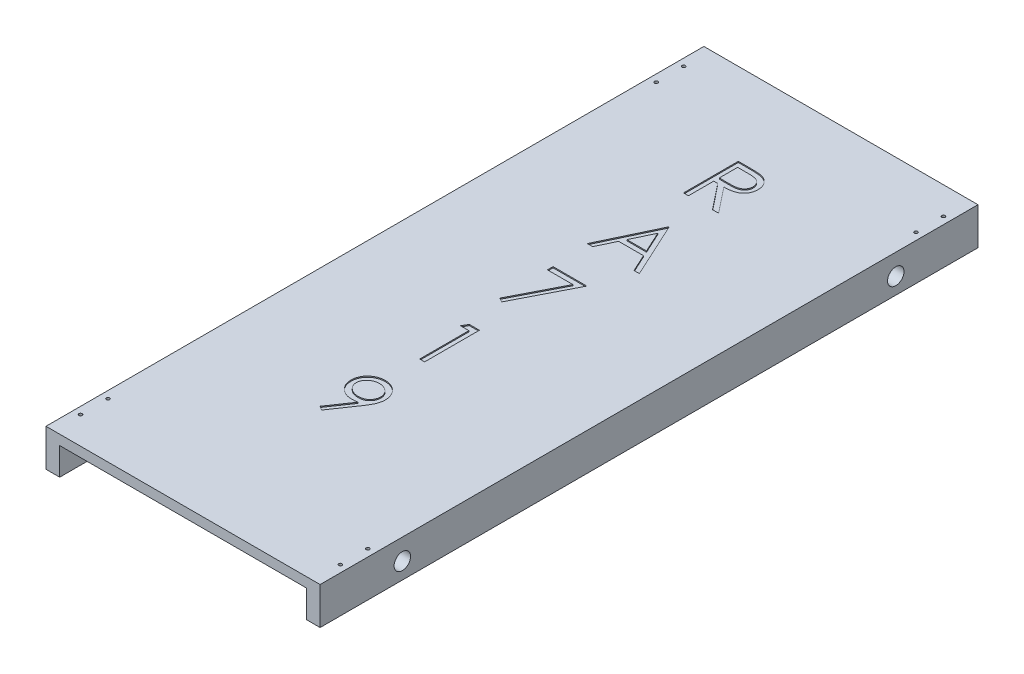
from build123d import *

# Parameters (mm, degrees)
BOSS_EXTRUDE1_DEPTH                = 1200
SKETCH3_R                          = 15
CUT_EXTRUDE1_DEPTH                 = 1302.77724669
CUT_EXTRUDE2_DEPTH                 = 2
CUT_EXTRUDE3_DEPTH                 = 2
F_6_0_6_DIAMETER_HOLE1_D           = 6
F_6_0_6_DIAMETER_HOLE1_CSINK_D     = 6.05
F_6_0_6_DIAMETER_HOLE1_CSINK_ANGLE = 90


with BuildPart() as part:
    # Sketch2 → Boss-Extrude1 (new body)
    with BuildSketch(Plane.XY):
        Polygon((0, 0), (0, 68), (500, 68), (500, 0), (475, 0), (475, 50), (25, 50), (25, 0), align=None)
    extrude(amount=BOSS_EXTRUDE1_DEPTH)

    # Sketch3 → Cut-Extrude1 (cut, through all)
    with BuildSketch(Plane(origin=(500, 0, 0), x_dir=(0, 0, -1), z_dir=(1, 0, 0))):
        with Locations((-1050, 30)):
            Circle(SKETCH3_R)
        with Locations((-150, 30)):
            Circle(SKETCH3_R)
    extrude(amount=-CUT_EXTRUDE1_DEPTH, mode=Mode.SUBTRACT)

    # Sketch4 → Cut-Extrude2 (cut)
    # profile 1 of 5: a face of its own
    with BuildSketch(Plane(origin=(0, 68, 0), x_dir=(1, 0, 0), z_dir=(0, 1, 0))):
        with BuildLine():
            Line((212.820512821, -150), (232.832532051, -150))
            add(Edge.make_bspline(
                [(232.832532051, -150), (234.167992866, -150.004445314), (236.732225563, -150.012980809), (240.405747574, -150.060574035), (243.743664631, -150.196984198), (246.744231468, -150.314372298), (249.407393039, -150.528427764), (251.741315632, -150.733017682), (253.735249846, -151.000836561), (254.942274169, -151.249562931), (255.488782051, -151.362179487)],
                knots=[0, 0, 0, 0, 1.410062039, 2.707475311, 3.878576406, 4.937260626, 5.877586885, 6.699081471, 7.410979367, 8, 8, 8, 8], degree=3))
            add(Edge.make_bspline(
                [(255.488782051, -151.362179487), (256.220399884, -151.542944212), (257.668028154, -151.900617459), (259.752315756, -152.656606054), (261.738439297, -153.531452472), (263.618148563, -154.558987338), (265.382028312, -155.746838186), (267.048265763, -157.074498827), (268.624421859, -158.534704706), (270.04675415, -160.164271606), (271.387869913, -161.873886168), (272.518973527, -163.722564935), (273.494015805, -165.655751436), (274.270316291, -167.693106229), (274.895401247, -169.814871139), (275.336150944, -172.040265332), (275.60047059, -174.359150334), (275.627380749, -175.940804871), (275.641025641, -176.742788462)],
                knots=[0, 0, 0, 0, 1.027469482, 2.033020251, 3.019912614, 3.986113645, 4.951240523, 5.91722682, 6.890402269, 7.87763091, 8.8651537, 9.85103654, 10.82876324, 11.815024772, 12.821070561, 13.842952187, 14.906261191, 16, 16, 16, 16], degree=3))
            add(Edge.make_bspline(
                [(275.641025641, -176.742788462), (275.599054266, -178.075220022), (275.517157244, -180.675139104), (274.753582853, -184.448307145), (273.502825147, -187.968001849), (271.779302603, -191.229791503), (269.58446044, -194.170095657), (266.946609266, -196.752680094), (263.864277509, -198.913820453), (260.994868482, -200.412472016), (258.460177062, -201.372269406), (256.373510983, -202.047593945), (254.097311626, -202.569364381), (251.65338778, -203.036796717), (249.031569051, -203.389702272), (246.238139354, -203.6481764), (243.271106451, -203.809720648), (241.232847326, -203.833777931), (240.184294872, -203.846153846)],
                knots=[0, 0, 0, 0, 1.260483769, 2.459530307, 3.627416485, 4.787058657, 5.939039949, 7.08810263, 8.267026773, 9.491475466, 10.141966685, 10.831826277, 11.566392101, 12.351337768, 13.187381173, 14.07005841, 15.007169909, 16, 16, 16, 16], degree=3))
            Line((240.184294872, -203.846153846), (276.923076923, -250))
            Line((276.923076923, -250), (265.825320513, -250))
            Line((265.825320513, -250), (229.086538462, -203.846153846))
            Line((229.086538462, -203.846153846), (221.794871795, -203.846153846))
            Line((221.794871795, -203.846153846), (221.794871795, -250))
            Line((221.794871795, -250), (212.820512821, -250))
            Line((212.820512821, -250), (212.820512821, -150))
        make_face()
        with BuildLine():
            Line((221.794871795, -160.256410256), (221.794871795, -193.58974359))
            Line((221.794871795, -193.58974359), (240.104166667, -193.729967949))
            add(Edge.make_bspline(
                [(240.104166667, -193.729967949), (240.959024922, -193.730346139), (242.615983696, -193.731079179), (245.013145548, -193.616971286), (247.245148739, -193.487162194), (249.303455944, -193.288609464), (251.188986668, -193.0327217), (252.900798474, -192.712636436), (254.441685671, -192.339720361), (256.238786769, -191.762531052), (258.245544808, -190.848073387), (260.426443661, -189.517630567), (262.283653311, -187.844227163), (263.852735091, -185.930699847), (265.113575991, -183.826807023), (266.002491829, -181.557767903), (266.566561609, -179.180865103), (266.633091479, -177.547204879), (266.666666667, -176.72275641)],
                knots=[0, 0, 0, 0, 1.146690395, 2.22261258, 3.21895312, 4.145990853, 4.996080663, 5.770904154, 6.481378293, 7.121626537, 8.300444488, 9.431385265, 10.535395872, 11.636531494, 12.74115979, 13.810798291, 14.895190096, 16, 16, 16, 16], degree=3))
            add(Edge.make_bspline(
                [(266.666666667, -176.72275641), (266.63232035, -175.918568589), (266.564258483, -174.32496177), (266.008579382, -171.991935762), (265.068882772, -169.790022901), (263.802533117, -167.728180473), (262.259700118, -165.85658802), (260.450619755, -164.255240789), (258.424757036, -162.933827513), (256.531294226, -162.089416641), (254.838888155, -161.571706548), (253.369469297, -161.207387582), (251.709141362, -160.91468847), (249.849842545, -160.680172445), (247.799510236, -160.478602609), (245.547777348, -160.342837505), (243.109583626, -160.262441388), (241.419671307, -160.25846742), (240.544871795, -160.256410256)],
                knots=[0, 0, 0, 0, 1.101028733, 2.181837193, 3.264309656, 4.369019818, 5.486613113, 6.575447106, 7.666700264, 8.788928104, 9.402425223, 10.0903467, 10.862060571, 11.710948788, 12.657782767, 13.684531032, 14.801375019, 16, 16, 16, 16], degree=3))
            Line((240.544871795, -160.256410256), (221.794871795, -160.256410256))
        make_face(mode=Mode.SUBTRACT)
    # profile 2 of 5: a face of its own
    with BuildSketch(Plane(origin=(0, 68, 0), x_dir=(1, 0, 0), z_dir=(0, 1, 0))):
        Polygon((253.846153846, -317.666666667), (300, -417.666666667), (290.244391026, -417.666666667), (275.460737179, -385.615384615), (230.128205128, -385.615384615), (214.923878205, -417.666666667), (205.128205128, -417.666666667), (252.564102564, -317.666666667), align=None)
        Polygon((253.104967949, -337.157852564), (234.99599359, -375.358974359), (270.733173077, -375.358974359), align=None, mode=Mode.SUBTRACT)
    # profile 3 of 5: a face of its own
    with BuildSketch(Plane(origin=(0, 68, 0), x_dir=(1, 0, 0), z_dir=(0, 1, 0))):
        Polygon((210.256410256, -485.333333333), (271.794871795, -485.333333333), (219.230769231, -587.897435897), (211.478365385, -583.630608974), (256.610576923, -495.58974359), (210.256410256, -495.58974359), align=None)
    # profile 4 of 5: a face of its own
    with BuildSketch(Plane(origin=(0, 68, 0), x_dir=(1, 0, 0), z_dir=(0, 1, 0))):
        Polygon((225.100160256, -653), (243.58974359, -653), (243.58974359, -753), (234.615384615, -753), (234.615384615, -663.256410256), (219.230769231, -663.256410256), align=None)
    # profile 5 of 5: a face of its own
    with BuildSketch(Plane(origin=(0, 68, 0), x_dir=(1, 0, 0), z_dir=(0, 1, 0))):
        with BuildLine():
            Line((225.641025641, -923.230769231), (218.469551282, -918.242788462))
            Line((218.469551282, -918.242788462), (246.274038462, -877.59775641))
            add(Edge.make_bspline(
                [(246.274038462, -877.59775641), (244.500017444, -877.814701077), (241.006871155, -878.24187722), (237.488668238, -878.320353069), (235.757211538, -878.358974359)],
                knots=[0, 0, 0, 0, 1.015715272, 2, 2, 2, 2], degree=3))
            add(Edge.make_bspline(
                [(235.757211538, -878.358974359), (234.707438744, -878.33208646), (232.646826549, -878.279307866), (229.617350762, -877.860970486), (226.706334746, -877.216681121), (223.921496005, -876.255288119), (221.252367295, -875.060482147), (218.704775484, -873.578853186), (216.282150041, -871.835816284), (214.010509757, -869.840587954), (211.944460074, -867.649786455), (210.103794424, -865.3310538), (208.574047796, -862.857454638), (207.303288214, -860.279448365), (206.339560969, -857.559981198), (205.637774181, -854.729998337), (205.205706913, -851.769665709), (205.154304183, -849.754661973), (205.128205128, -848.731570513)],
                knots=[0, 0, 0, 0, 1.060718605, 2.082097864, 3.085795603, 4.069760067, 5.054557537, 6.03741023, 7.043284206, 8.066802108, 9.088538119, 10.083643548, 11.053783639, 12.022749082, 12.983451788, 13.964007469, 14.966251758, 16, 16, 16, 16], degree=3))
            add(Edge.make_bspline(
                [(205.128205128, -848.731570513), (205.177760408, -847.332466149), (205.275027369, -844.586308105), (206.057842148, -840.573914704), (207.34528041, -836.780013458), (209.140376889, -833.214579346), (211.40136893, -829.928901083), (214.118757221, -826.968655108), (217.276013343, -824.375944998), (220.80121389, -822.147257072), (224.611300197, -820.354828578), (228.601833285, -819.033705707), (232.742236716, -818.256598626), (235.547027291, -818.154145451), (236.959134615, -818.102564103)],
                knots=[0, 0, 0, 0, 1.022988612, 2.007919123, 2.978103895, 3.94594894, 4.918897164, 5.887013414, 6.875921846, 7.89917871, 8.930658928, 9.948724884, 10.967259574, 12, 12, 12, 12], degree=3))
            add(Edge.make_bspline(
                [(236.959134615, -818.102564103), (238.344518032, -818.154854476), (241.081905084, -818.258175324), (245.107305272, -819.014860155), (248.962762899, -820.290193664), (252.626905376, -822.052609771), (256.019460011, -824.261778562), (259.070197474, -826.894193526), (261.709498591, -829.951494304), (263.933038041, -833.359736877), (265.717896335, -837.021650625), (267.005675849, -840.844048411), (267.798408391, -844.799440448), (267.898303451, -847.479282564), (267.948717949, -848.831730769)],
                knots=[0, 0, 0, 0, 1.026385292, 2.028040595, 3.023318987, 4.028184125, 5.03290303, 6.015178782, 7.004435299, 8.016004309, 9.023023918, 10.015172535, 10.998308025, 12, 12, 12, 12], degree=3))
            add(Edge.make_bspline(
                [(267.948717949, -848.831730769), (267.915049123, -849.881552688), (267.84676033, -852.01085385), (267.368580127, -855.246006502), (266.556574835, -858.544613059), (265.635097729, -861.336658651), (264.745607224, -863.642614359), (263.908432033, -865.464088073), (262.979513361, -867.381267025), (261.896120061, -869.374048108), (260.731483012, -871.467834821), (259.415503682, -873.6416267), (257.978201631, -875.898340791), (256.954495353, -877.419686163), (256.430288462, -878.198717949)],
                knots=[0, 0, 0, 0, 1.179839688, 2.393009684, 3.667231171, 4.993948276, 5.694988576, 6.444077775, 7.246288328, 8.089075292, 8.993003841, 9.939041771, 10.944649915, 12, 12, 12, 12], degree=3))
            Line((256.430288462, -878.198717949), (225.641025641, -923.230769231))
        make_face()
        with BuildLine():
            add(Edge.make_bspline(
                [(237.419871795, -868.102564103), (238.215129341, -868.080838852), (239.763225429, -868.038547175), (242.031148258, -867.781140264), (244.171839784, -867.324740661), (246.191018336, -866.669891745), (248.108929819, -865.879701205), (249.895110625, -864.87364446), (251.551055631, -863.673169176), (253.087853547, -862.324311586), (254.452539254, -860.825723484), (255.668054417, -859.257234722), (256.701213486, -857.611960152), (257.517307117, -855.869295515), (258.188294987, -854.071660988), (258.65166676, -852.190107981), (258.908361996, -850.234439391), (258.952121279, -848.905906305), (258.974358974, -848.230769231)],
                knots=[0, 0, 0, 0, 1.163407946, 2.26475976, 3.333800367, 4.359385343, 5.366239384, 6.363380779, 7.350133999, 8.353570782, 9.349036268, 10.310270964, 11.253520213, 12.184142, 13.120487599, 14.056272588, 15.012232024, 16, 16, 16, 16], degree=3))
            add(Edge.make_bspline(
                [(258.974358974, -848.230769231), (258.955225569, -847.555350224), (258.917520848, -846.224354225), (258.61502657, -844.265790228), (258.082877338, -842.388839919), (257.36886349, -840.583227635), (256.428285266, -838.863788439), (255.299614245, -837.208934959), (253.958687108, -835.62915988), (252.415756646, -834.161617492), (250.751912275, -832.808820371), (248.978755125, -831.614932486), (247.110900382, -830.614326875), (245.159743529, -829.788642022), (243.121219274, -829.144305574), (240.996533896, -828.680952298), (238.774950882, -828.424616453), (237.266914134, -828.381133753), (236.498397436, -828.358974359)],
                knots=[0, 0, 0, 0, 0.972161553, 1.915763587, 2.844109794, 3.775983486, 4.705125789, 5.659731448, 6.655561913, 7.682237399, 8.721216875, 9.739758359, 10.754845918, 11.767244016, 12.7857855, 13.828538656, 14.893392813, 16, 16, 16, 16], degree=3))
            add(Edge.make_bspline(
                [(236.498397436, -828.358974359), (235.736564483, -828.38116955), (234.241854503, -828.424716332), (232.040021376, -828.680465051), (229.929702295, -829.147421743), (227.897084573, -829.788343565), (225.945985696, -830.614388469), (224.078219049, -831.614984916), (222.304647143, -832.808545551), (220.642397977, -834.162681907), (219.096743061, -835.622328939), (217.778870804, -837.21585548), (216.647616745, -838.862927607), (215.70833095, -840.583456414), (214.993973313, -842.388778859), (214.461916124, -844.265806767), (214.159397117, -846.224349915), (214.121695787, -847.555348774), (214.102564103, -848.230769231)],
                knots=[0, 0, 0, 0, 1.099389452, 2.15699305, 3.192601482, 4.213358962, 5.227959689, 6.245255729, 7.266013209, 8.307253147, 9.336162325, 10.327954924, 11.284637477, 12.215801273, 13.149702402, 14.080068371, 15.025723358, 16, 16, 16, 16], degree=3))
            add(Edge.make_bspline(
                [(214.102564103, -848.230769231), (214.119876277, -848.906432052), (214.154019054, -850.2389628), (214.483384475, -852.196859739), (215.03419247, -854.073665282), (215.771889344, -855.887628339), (216.743363348, -857.62111), (217.93547329, -859.265891769), (219.332774605, -860.840618917), (220.916588539, -862.32082497), (222.649964566, -863.679458557), (224.501300169, -864.8660409), (226.43872408, -865.868110741), (228.469056388, -866.672150281), (230.57725067, -867.318197809), (232.782254424, -867.780299104), (235.076775495, -868.036078154), (236.631346404, -868.080189496), (237.419871795, -868.102564103)],
                knots=[0, 0, 0, 0, 0.952633368, 1.87876736, 2.791047057, 3.707742249, 4.635551637, 5.587206343, 6.568248508, 7.601284464, 8.641511608, 9.671105535, 10.699146789, 11.713763218, 12.747829548, 13.806491675, 14.887386225, 16, 16, 16, 16], degree=3))
        make_face(mode=Mode.SUBTRACT)
    extrude(amount=-CUT_EXTRUDE2_DEPTH, mode=Mode.SUBTRACT)

    # Sketch5 → Cut-Extrude3 (cut)
    # profile 1 of 5: a face of its own
    with BuildSketch(Plane.XZ.offset(-50)):
        with BuildLine():
            Line((212.820512821, 1050), (232.832532051, 1050))
            add(Edge.make_bspline(
                [(232.832532051, 1050), (234.167992866, 1049.995554686), (236.732225563, 1049.987019191), (240.405747574, 1049.939425965), (243.743664631, 1049.803015802), (246.744231468, 1049.685627702), (249.407393039, 1049.471572236), (251.741315632, 1049.266982318), (253.735249846, 1048.999163439), (254.942274169, 1048.750437069), (255.488782051, 1048.637820513)],
                knots=[0, 0, 0, 0, 1.410062039, 2.707475311, 3.878576406, 4.937260626, 5.877586885, 6.699081471, 7.410979367, 8, 8, 8, 8], degree=3))
            add(Edge.make_bspline(
                [(255.488782051, 1048.637820513), (256.220399884, 1048.457055788), (257.668028154, 1048.099382541), (259.752315756, 1047.343393946), (261.738439297, 1046.468547528), (263.618148563, 1045.441012662), (265.382028312, 1044.253161814), (267.048265763, 1042.925501173), (268.624421859, 1041.465295294), (270.04675415, 1039.835728394), (271.387869913, 1038.126113832), (272.518973527, 1036.277435065), (273.494015805, 1034.344248564), (274.270316291, 1032.306893771), (274.895401247, 1030.185128861), (275.336150944, 1027.959734668), (275.60047059, 1025.640849666), (275.627380749, 1024.059195129), (275.641025641, 1023.257211538)],
                knots=[0, 0, 0, 0, 1.027469482, 2.033020251, 3.019912614, 3.986113645, 4.951240523, 5.91722682, 6.890402269, 7.87763091, 8.8651537, 9.85103654, 10.82876324, 11.815024772, 12.821070561, 13.842952187, 14.906261191, 16, 16, 16, 16], degree=3))
            add(Edge.make_bspline(
                [(275.641025641, 1023.257211538), (275.599054266, 1021.924779978), (275.517157244, 1019.324860896), (274.753582853, 1015.551692855), (273.502825147, 1012.031998151), (271.779302603, 1008.770208497), (269.58446044, 1005.829904343), (266.946609266, 1003.247319906), (263.864277509, 1001.086179547), (260.994868482, 999.587527984), (258.460177062, 998.627730594), (256.373510983, 997.952406055), (254.097311626, 997.430635619), (251.65338778, 996.963203283), (249.031569051, 996.610297728), (246.238139354, 996.3518236), (243.271106451, 996.190279352), (241.232847326, 996.166222069), (240.184294872, 996.153846154)],
                knots=[0, 0, 0, 0, 1.260483769, 2.459530307, 3.627416485, 4.787058657, 5.939039949, 7.08810263, 8.267026773, 9.491475466, 10.141966685, 10.831826277, 11.566392101, 12.351337768, 13.187381173, 14.07005841, 15.007169909, 16, 16, 16, 16], degree=3))
            Line((240.184294872, 996.153846154), (276.923076923, 950))
            Line((276.923076923, 950), (265.825320513, 950))
            Line((265.825320513, 950), (229.086538462, 996.153846154))
            Line((229.086538462, 996.153846154), (221.794871795, 996.153846154))
            Line((221.794871795, 996.153846154), (221.794871795, 950))
            Line((221.794871795, 950), (212.820512821, 950))
            Line((212.820512821, 950), (212.820512821, 1050))
        make_face()
        with BuildLine():
            Line((221.794871795, 1039.743589744), (221.794871795, 1006.41025641))
            Line((221.794871795, 1006.41025641), (240.104166667, 1006.270032051))
            add(Edge.make_bspline(
                [(240.104166667, 1006.270032051), (240.959024922, 1006.269653861), (242.615983696, 1006.268920821), (245.013145548, 1006.383028714), (247.245148739, 1006.512837806), (249.303455944, 1006.711390536), (251.188986668, 1006.9672783), (252.900798474, 1007.287363564), (254.441685671, 1007.660279639), (256.238786769, 1008.237468948), (258.245544808, 1009.151926613), (260.426443661, 1010.482369433), (262.283653311, 1012.155772837), (263.852735091, 1014.069300153), (265.113575991, 1016.173192977), (266.002491829, 1018.442232097), (266.566561609, 1020.819134897), (266.633091479, 1022.452795121), (266.666666667, 1023.27724359)],
                knots=[0, 0, 0, 0, 1.146690395, 2.22261258, 3.21895312, 4.145990853, 4.996080663, 5.770904154, 6.481378293, 7.121626537, 8.300444488, 9.431385265, 10.535395872, 11.636531494, 12.74115979, 13.810798291, 14.895190096, 16, 16, 16, 16], degree=3))
            add(Edge.make_bspline(
                [(266.666666667, 1023.27724359), (266.63232035, 1024.081431411), (266.564258483, 1025.67503823), (266.008579382, 1028.008064238), (265.068882772, 1030.209977099), (263.802533117, 1032.271819527), (262.259700118, 1034.14341198), (260.450619755, 1035.744759211), (258.424757036, 1037.066172487), (256.531294226, 1037.910583359), (254.838888155, 1038.428293452), (253.369469297, 1038.792612418), (251.709141362, 1039.08531153), (249.849842545, 1039.319827555), (247.799510236, 1039.521397391), (245.547777348, 1039.657162495), (243.109583626, 1039.737558612), (241.419671307, 1039.74153258), (240.544871795, 1039.743589744)],
                knots=[0, 0, 0, 0, 1.101028733, 2.181837193, 3.264309656, 4.369019818, 5.486613113, 6.575447106, 7.666700264, 8.788928104, 9.402425223, 10.0903467, 10.862060571, 11.710948788, 12.657782767, 13.684531032, 14.801375019, 16, 16, 16, 16], degree=3))
            Line((240.544871795, 1039.743589744), (221.794871795, 1039.743589744))
        make_face(mode=Mode.SUBTRACT)
    # profile 2 of 5: a face of its own
    with BuildSketch(Plane.XZ.offset(-50)):
        Polygon((253.846153846, 882.333333333), (300, 782.333333333), (290.244391026, 782.333333333), (275.460737179, 814.384615385), (230.128205128, 814.384615385), (214.923878205, 782.333333333), (205.128205128, 782.333333333), (252.564102564, 882.333333333), align=None)
        Polygon((253.104967949, 862.842147436), (234.99599359, 824.641025641), (270.733173077, 824.641025641), align=None, mode=Mode.SUBTRACT)
    # profile 3 of 5: a face of its own
    with BuildSketch(Plane.XZ.offset(-50)):
        Polygon((210.256410256, 714.666666667), (271.794871795, 714.666666667), (219.230769231, 612.102564103), (211.478365385, 616.369391026), (256.610576923, 704.41025641), (210.256410256, 704.41025641), align=None)
    # profile 4 of 5: a face of its own
    with BuildSketch(Plane.XZ.offset(-50)):
        Polygon((225.100160256, 547), (243.58974359, 547), (243.58974359, 447), (234.615384615, 447), (234.615384615, 536.743589744), (219.230769231, 536.743589744), align=None)
    # profile 5 of 5: a face of its own
    with BuildSketch(Plane.XZ.offset(-50)):
        with BuildLine():
            Line((225.641025641, 276.769230769), (218.469551282, 281.757211538))
            Line((218.469551282, 281.757211538), (246.274038462, 322.40224359))
            add(Edge.make_bspline(
                [(246.274038462, 322.40224359), (244.500017444, 322.185298923), (241.006871155, 321.75812278), (237.488668238, 321.679646931), (235.757211538, 321.641025641)],
                knots=[0, 0, 0, 0, 1.015715272, 2, 2, 2, 2], degree=3))
            add(Edge.make_bspline(
                [(235.757211538, 321.641025641), (234.707438744, 321.66791354), (232.646826549, 321.720692134), (229.617350762, 322.139029514), (226.706334746, 322.783318879), (223.921496005, 323.744711881), (221.252367295, 324.939517853), (218.704775484, 326.421146814), (216.282150041, 328.164183716), (214.010509757, 330.159412046), (211.944460074, 332.350213545), (210.103794424, 334.6689462), (208.574047796, 337.142545362), (207.303288214, 339.720551635), (206.339560969, 342.440018802), (205.637774181, 345.270001663), (205.205706913, 348.230334291), (205.154304183, 350.245338027), (205.128205128, 351.268429487)],
                knots=[0, 0, 0, 0, 1.060718605, 2.082097864, 3.085795603, 4.069760067, 5.054557537, 6.03741023, 7.043284206, 8.066802108, 9.088538119, 10.083643548, 11.053783639, 12.022749082, 12.983451788, 13.964007469, 14.966251758, 16, 16, 16, 16], degree=3))
            add(Edge.make_bspline(
                [(205.128205128, 351.268429487), (205.177760408, 352.667533851), (205.275027369, 355.413691895), (206.057842148, 359.426085296), (207.34528041, 363.219986542), (209.140376889, 366.785420654), (211.40136893, 370.071098917), (214.118757221, 373.031344892), (217.276013343, 375.624055002), (220.80121389, 377.852742928), (224.611300197, 379.645171422), (228.601833285, 380.966294293), (232.742236716, 381.743401374), (235.547027291, 381.845854549), (236.959134615, 381.897435897)],
                knots=[0, 0, 0, 0, 1.022988612, 2.007919123, 2.978103895, 3.94594894, 4.918897164, 5.887013414, 6.875921846, 7.89917871, 8.930658928, 9.948724884, 10.967259574, 12, 12, 12, 12], degree=3))
            add(Edge.make_bspline(
                [(236.959134615, 381.897435897), (238.344518032, 381.845145524), (241.081905084, 381.741824676), (245.107305272, 380.985139845), (248.962762899, 379.709806336), (252.626905376, 377.947390229), (256.019460011, 375.738221438), (259.070197474, 373.105806474), (261.709498591, 370.048505696), (263.933038041, 366.640263123), (265.717896335, 362.978349375), (267.005675849, 359.155951589), (267.798408391, 355.200559552), (267.898303451, 352.520717436), (267.948717949, 351.168269231)],
                knots=[0, 0, 0, 0, 1.026385292, 2.028040595, 3.023318987, 4.028184125, 5.03290303, 6.015178782, 7.004435299, 8.016004309, 9.023023918, 10.015172535, 10.998308025, 12, 12, 12, 12], degree=3))
            add(Edge.make_bspline(
                [(267.948717949, 351.168269231), (267.915049123, 350.118447312), (267.84676033, 347.98914615), (267.368580127, 344.753993498), (266.556574835, 341.455386941), (265.635097729, 338.663341349), (264.745607224, 336.357385641), (263.908432033, 334.535911927), (262.979513361, 332.618732975), (261.896120061, 330.625951892), (260.731483012, 328.532165179), (259.415503682, 326.3583733), (257.978201631, 324.101659209), (256.954495353, 322.580313837), (256.430288462, 321.801282051)],
                knots=[0, 0, 0, 0, 1.179839688, 2.393009684, 3.667231171, 4.993948276, 5.694988576, 6.444077775, 7.246288328, 8.089075292, 8.993003841, 9.939041771, 10.944649915, 12, 12, 12, 12], degree=3))
            Line((256.430288462, 321.801282051), (225.641025641, 276.769230769))
        make_face()
        with BuildLine():
            add(Edge.make_bspline(
                [(237.419871795, 331.897435897), (238.215129341, 331.919161148), (239.763225429, 331.961452825), (242.031148258, 332.218859736), (244.171839784, 332.675259339), (246.191018336, 333.330108255), (248.108929819, 334.120298795), (249.895110625, 335.12635554), (251.551055631, 336.326830824), (253.087853547, 337.675688414), (254.452539254, 339.174276516), (255.668054417, 340.742765278), (256.701213486, 342.388039848), (257.517307117, 344.130704485), (258.188294987, 345.928339012), (258.65166676, 347.809892019), (258.908361996, 349.765560609), (258.952121279, 351.094093695), (258.974358974, 351.769230769)],
                knots=[0, 0, 0, 0, 1.163407946, 2.26475976, 3.333800367, 4.359385343, 5.366239384, 6.363380779, 7.350133999, 8.353570782, 9.349036268, 10.310270964, 11.253520213, 12.184142, 13.120487599, 14.056272588, 15.012232024, 16, 16, 16, 16], degree=3))
            add(Edge.make_bspline(
                [(258.974358974, 351.769230769), (258.955225569, 352.444649776), (258.917520848, 353.775645775), (258.61502657, 355.734209772), (258.082877338, 357.611160081), (257.36886349, 359.416772365), (256.428285266, 361.136211561), (255.299614245, 362.791065041), (253.958687108, 364.37084012), (252.415756646, 365.838382508), (250.751912275, 367.191179629), (248.978755125, 368.385067514), (247.110900382, 369.385673125), (245.159743529, 370.211357978), (243.121219274, 370.855694426), (240.996533896, 371.319047702), (238.774950882, 371.575383547), (237.266914134, 371.618866247), (236.498397436, 371.641025641)],
                knots=[0, 0, 0, 0, 0.972161553, 1.915763587, 2.844109794, 3.775983486, 4.705125789, 5.659731448, 6.655561913, 7.682237399, 8.721216875, 9.739758359, 10.754845918, 11.767244016, 12.7857855, 13.828538656, 14.893392813, 16, 16, 16, 16], degree=3))
            add(Edge.make_bspline(
                [(236.498397436, 371.641025641), (235.736564483, 371.61883045), (234.241854503, 371.575283668), (232.040021376, 371.319534949), (229.929702295, 370.852578257), (227.897084573, 370.211656435), (225.945985696, 369.385611531), (224.078219049, 368.385015084), (222.304647143, 367.191454449), (220.642397977, 365.837318093), (219.096743061, 364.377671061), (217.778870804, 362.78414452), (216.647616745, 361.137072393), (215.70833095, 359.416543586), (214.993973313, 357.611221141), (214.461916124, 355.734193233), (214.159397117, 353.775650085), (214.121695787, 352.444651226), (214.102564103, 351.769230769)],
                knots=[0, 0, 0, 0, 1.099389452, 2.15699305, 3.192601482, 4.213358962, 5.227959689, 6.245255729, 7.266013209, 8.307253147, 9.336162325, 10.327954924, 11.284637477, 12.215801273, 13.149702402, 14.080068371, 15.025723358, 16, 16, 16, 16], degree=3))
            add(Edge.make_bspline(
                [(214.102564103, 351.769230769), (214.119876277, 351.093567948), (214.154019054, 349.7610372), (214.483384475, 347.803140261), (215.03419247, 345.926334718), (215.771889344, 344.112371661), (216.743363348, 342.37889), (217.93547329, 340.734108231), (219.332774605, 339.159381083), (220.916588539, 337.67917503), (222.649964566, 336.320541443), (224.501300169, 335.1339591), (226.43872408, 334.131889259), (228.469056388, 333.327849719), (230.57725067, 332.681802191), (232.782254424, 332.219700896), (235.076775495, 331.963921846), (236.631346404, 331.919810504), (237.419871795, 331.897435897)],
                knots=[0, 0, 0, 0, 0.952633368, 1.87876736, 2.791047057, 3.707742249, 4.635551637, 5.587206343, 6.568248508, 7.601284464, 8.641511608, 9.671105535, 10.699146789, 11.713763218, 12.747829548, 13.806491675, 14.887386225, 16, 16, 16, 16], degree=3))
        make_face(mode=Mode.SUBTRACT)
    extrude(amount=-CUT_EXTRUDE3_DEPTH, mode=Mode.SUBTRACT)

    # Ø6.0 (6) Diameter Hole1 (through all)
    with Locations(Plane(origin=(0, 0, 0), x_dir=(-1, 0, 0), z_dir=(0, -1, 0))):
        with Locations((-487, -1150), (-487, -1100), (-487, -50), (-487, -100), (-13, -50), (-13, -100), (-13, -1150), (-13, -1100)):
            CounterSinkHole(F_6_0_6_DIAMETER_HOLE1_D / 2, F_6_0_6_DIAMETER_HOLE1_CSINK_D / 2, counter_sink_angle=F_6_0_6_DIAMETER_HOLE1_CSINK_ANGLE)


solid = part.part
